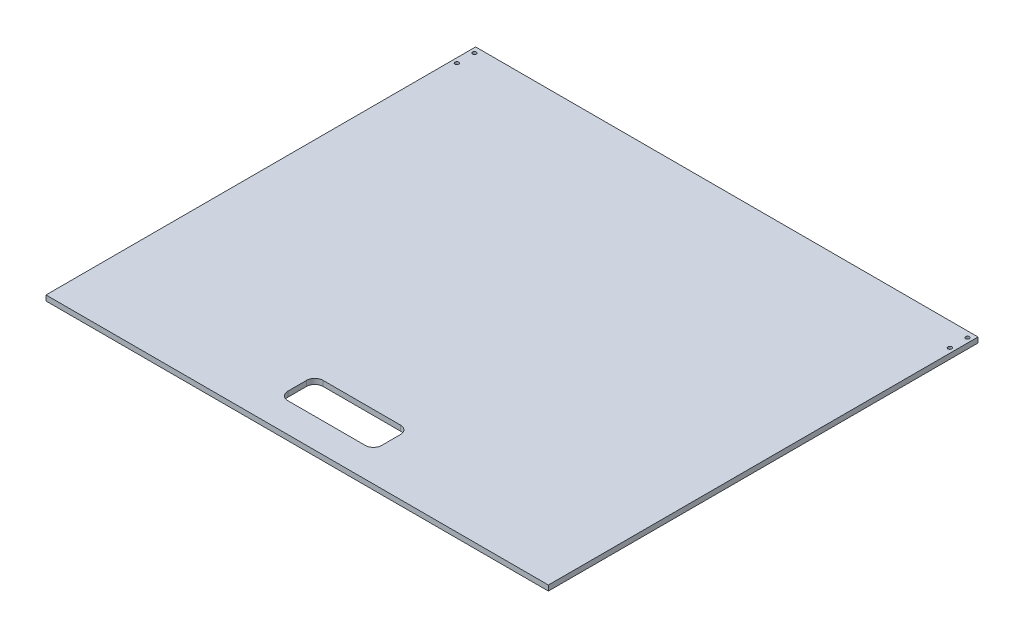
from build123d import *

# Parameters (mm, degrees)
SKETCH1_W           = 428
SKETCH1_H           = 366
BOSS_EXTRUDE1_DEPTH = 4.5
SKETCH2_R           = 1.6
CUT_EXTRUDE1_DEPTH  = 282.611878301
CUT_EXTRUDE2_DEPTH  = 282.611878301


with BuildPart() as part:
    # Sketch1 → Boss-Extrude1 (new body)
    with BuildSketch(Plane(origin=(0, 0, 0), x_dir=(1, 0, 0), z_dir=(0, 1, 0))):
        Rectangle(SKETCH1_W, SKETCH1_H)
    extrude(amount=BOSS_EXTRUDE1_DEPTH)

    # Sketch2 → Cut-Extrude1 (cut, through all)
    with BuildSketch(Plane.XZ):
        with Locations((210, -163)):
            Circle(SKETCH2_R)
        with Locations((210, -178)):
            Circle(SKETCH2_R)
    cut_extrude1 = extrude(amount=-CUT_EXTRUDE1_DEPTH, mode=Mode.SUBTRACT)

    # Mirror1: Cut-Extrude1 across plane
    add(cut_extrude1.mirror(Plane(origin=(0, 0, 0), x_dir=(0, 0, 1), z_dir=(1, 0, 0))), mode=Mode.SUBTRACT)

    # Sketch3 → Cut-Extrude2 (cut, through all)
    with BuildSketch(Plane(origin=(0, 4.5, 0), x_dir=(1, 0, 0), z_dir=(0, 1, 0))):
        with BuildLine():
            Line((-33, -158), (33, -158))
            ThreePointArc((33, -158), (37.949747468, -155.949747468), (40, -151))
            Line((40, -151), (40, -135))
            ThreePointArc((40, -135), (37.949747468, -130.050252532), (33, -128))
            Line((33, -128), (-33, -128))
            ThreePointArc((-33, -128), (-37.949747468, -130.050252532), (-40, -135))
            Line((-40, -135), (-40, -151))
            ThreePointArc((-40, -151), (-37.949747468, -155.949747468), (-33, -158))
        make_face()
    extrude(amount=-CUT_EXTRUDE2_DEPTH, mode=Mode.SUBTRACT)


solid = part.part
